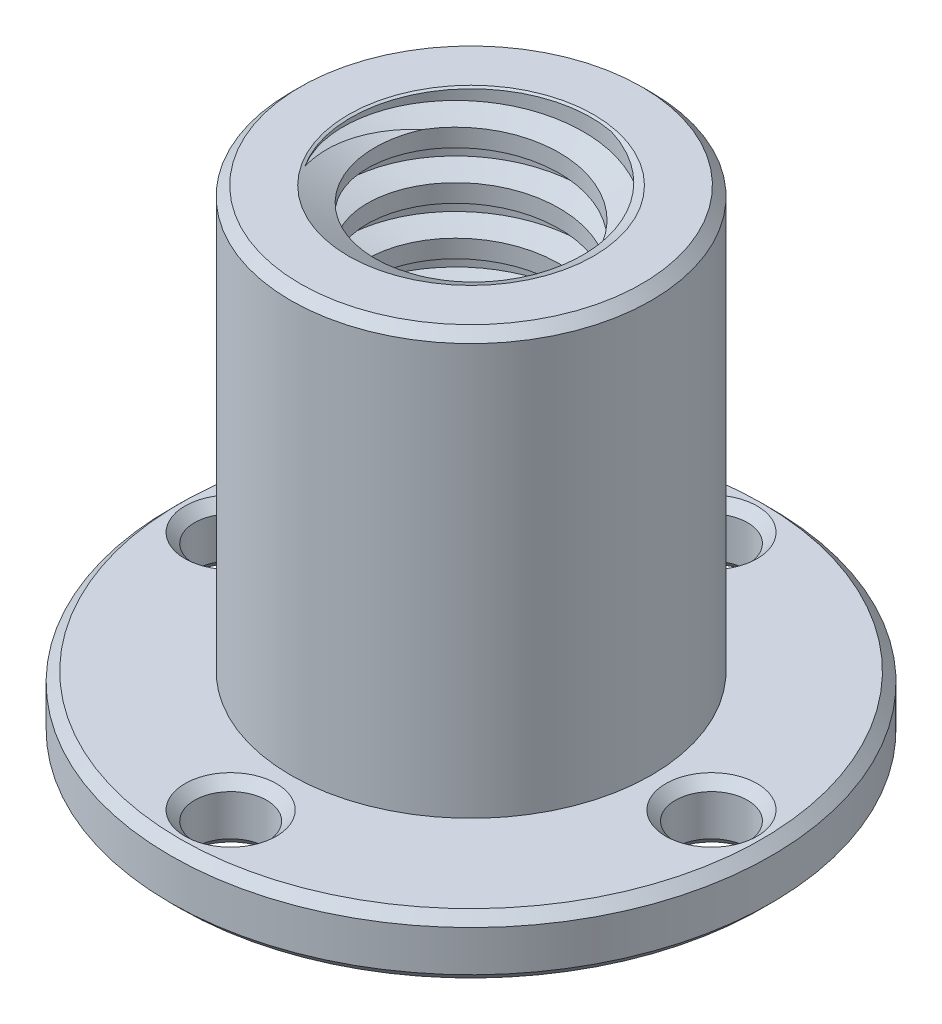
from build123d import *

# Parameters (mm, degrees)
SKETCH1_R                    = 15.875
BOSS_EXTRUDE1_DEPTH          = 25.4
CUT_EXTRUDE1_REACH           = 35.9
SKETCH2_R                    = 6.35
SWEEP1_PITCH                 = 2.54
SKETCH5_R                    = 6.477
CUT_EXTRUDE3_OTHER_WAY_DEPTH = 36.842421757
CUT_EXTRUDE3_OTHER_WAY_TAPER = -60
SKETCH6_R                    = 6.477
CUT_EXTRUDE4_OTHER_WAY_DEPTH = 34.899723619
CUT_EXTRUDE4_OTHER_WAY_TAPER = -60
SKETCH7_OUTSIDE_W            = 44.068
SKETCH7_OUTSIDE_H            = 44.068
SKETCH7_OUTSIDE_R            = 9.525
CUT_EXTRUDE5_DEPTH           = 22.225
SKETCH8_R                    = 1.905
CUT_EXTRUDE6_DEPTH           = 32.590851198
CHAMFER1_SIZE                = 0.508


with BuildPart() as part:
    # Sketch1 → Boss-Extrude1 (new body)
    with BuildSketch(Plane(origin=(0, 0, 0), x_dir=(1, 0, 0), z_dir=(0, 1, 0))):
        with Locations(Location((0, 0, 0), (0, 0, 270))):
            Circle(SKETCH1_R)
    extrude(amount=BOSS_EXTRUDE1_DEPTH)

    # Sketch2 → Cut-Extrude1 (cut, up to next)
    with BuildSketch(Plane(origin=(0, 25.4, 0), x_dir=(1, 0, 0), z_dir=(0, 1, 0)), mode=Mode.PRIVATE) as cut_extrude1_sk1:
        with Locations(Location((0, 0, 0), (0, 0, 270))):
            Circle(SKETCH2_R)
    cut_extrude1_tool1 = extrude(cut_extrude1_sk1.sketch, amount=-CUT_EXTRUDE1_REACH, mode=Mode.PRIVATE) & part.part
    add(cut_extrude1_tool1.solids().sort_by_distance((0, 25.4, 0))[0], mode=Mode.SUBTRACT)

    # Sweep1: the profile of Sketch4 profile screwed along a right-hand helix of 11 turns, 10 arcs to a turn; built about Z, then put on its axis
    sweep1_z = Axis((0, 0, 0), (0, 0, 1))
    sweep1_corners = [(6.3503, 0, -1.598521917), (5.08, 0, -1.27), (5.08, 0, -0.328444332), (6.3503, 0, 7.7585e-05)]
    with BuildLine(mode=Mode.PRIVATE) as sweep1_profile:
        Line(sweep1_corners[0], sweep1_corners[1])
        Line(sweep1_corners[1], sweep1_corners[2])
        Line(sweep1_corners[2], sweep1_corners[3])
        Line(sweep1_corners[3], sweep1_corners[0])
    sweep1_cap = Face(sweep1_profile.wire())
    sweep1_turn_angles = [0, 18, 36, 54, 72, 90, 108, 126, 144, 162, 180, 198, 216, 234, 252, 270, 288, 306, 324, 342, 360]
    sweep1_turn_weights = [1, 0.9510565162951535, 1, 0.9510565162951535, 1, 0.9510565162951535, 1, 0.9510565162951535, 1, 0.9510565162951535, 1, 0.9510565162951535, 1, 0.9510565162951535, 1, 0.9510565162951535, 1, 0.9510565162951535, 1, 0.9510565162951535, 1]
    sweep1_turn_rails = [Edge.make_bspline([Vector(p[0], p[1], 0).rotate(sweep1_z, sweep1_turn_angles[k]) / sweep1_turn_weights[k] + Vector(0, 0, p[2] + SWEEP1_PITCH * sweep1_turn_angles[k] / 360) for k in range(21)], [0, 0, 0, 1, 1, 2, 2, 3, 3, 4, 4, 5, 5, 6, 6, 7, 7, 8, 8, 9, 9, 10, 10, 10], 2, sweep1_turn_weights) for p in sweep1_corners]
    sweep1_turn_sides = [Face.make_surface_from_curves(sweep1_turn_rails[p[0]], sweep1_turn_rails[p[1]]) for p in [(0, 1), (1, 2), (2, 3), (3, 0)]]
    sweep1 = Plane(origin=(0, 25.4, 0), x_dir=(0, 0, -1), z_dir=(0, -1, 0)) * Solid(Shell([*[p.moved(Location((0, 0, SWEEP1_PITCH * i))) for i in range(11) for p in sweep1_turn_sides], sweep1_cap, sweep1_cap.rotate(sweep1_z, 3960).moved(Location((0, 0, SWEEP1_PITCH * 3960 / 360)))]))
    add(sweep1)

    # Cut-Extrude3 cone 1 section (through the dimple's axis) → Cut-Extrude3 (revolve, cut)
    with BuildSketch(Plane(origin=(0, 25.4, 0), x_dir=(0, 0, 1), z_dir=(1, 0, 0))):
        Polygon((0, 0), (6.477, 0), (0, 3.739497694), align=None)
    revolve(axis=Axis((0, 25.4, 0), (0, -1, 0)), mode=Mode.SUBTRACT)

    # Sketch5 → Cut-Extrude3 other way (cut)
    with BuildSketch(Plane(origin=(0, 25.4, 0), x_dir=(1, 0, 0), z_dir=(0, 1, 0))):
        Circle(SKETCH5_R)
    extrude(amount=CUT_EXTRUDE3_OTHER_WAY_DEPTH, taper=CUT_EXTRUDE3_OTHER_WAY_TAPER, mode=Mode.SUBTRACT)

    # Cut-Extrude4 cone 1 section (through the dimple's axis) → Cut-Extrude4 (revolve, cut)
    with BuildSketch(Plane(origin=(0, 0, 0), x_dir=(0, 0, -1), z_dir=(1, 0, 0))):
        Polygon((0, 0), (6.477, 0), (0, 3.739497694), align=None)
    revolve(axis=Axis((0, 0, 0), (0, 1, 0)), mode=Mode.SUBTRACT)

    # Sketch6 → Cut-Extrude4 other way (cut)
    with BuildSketch(Plane.XZ):
        Circle(SKETCH6_R)
    extrude(amount=CUT_EXTRUDE4_OTHER_WAY_DEPTH, taper=CUT_EXTRUDE4_OTHER_WAY_TAPER, mode=Mode.SUBTRACT)

    # Sketch7 outside → Cut-Extrude5 (cut)
    with BuildSketch(Plane(origin=(0, 25.4, 0), x_dir=(1, 0, 0), z_dir=(0, 1, 0))):
        Rectangle(SKETCH7_OUTSIDE_W, SKETCH7_OUTSIDE_H)
        with Locations(Location((0, 0, 0), (0, 0, 270))):
            Circle(SKETCH7_OUTSIDE_R, mode=Mode.SUBTRACT)
    extrude(amount=-CUT_EXTRUDE5_DEPTH, mode=Mode.SUBTRACT)

    # Sketch8 → Cut-Extrude6 (cut, through all)
    with BuildSketch(Plane(origin=(0, 3.175, 0), x_dir=(1, 0, 0), z_dir=(0, 1, 0))):
        with Locations(Location((-12.7, 0, 0), (0, 0, 270))):
            Circle(SKETCH8_R)
        with Locations(Location((0, 12.7, 0), (0, 0, 270))):
            Circle(SKETCH8_R)
        with Locations(Location((12.7, 0, 0), (0, 0, 270))):
            Circle(SKETCH8_R)
        with Locations(Location((0, -12.7, 0), (0, 0, 270))):
            Circle(SKETCH8_R)
    extrude(amount=-CUT_EXTRUDE6_DEPTH, mode=Mode.SUBTRACT)

    # Chamfer1
    chamfer1_edges = [part.edges().sort_by_distance(p)[0] for p in [
        (0, 0, -14.605),
        (0, 3.175, -14.605),
        (12.7, 0, -1.905),
        (12.7, 3.175, -1.905),
        (0, 0, 10.795),
        (0, 3.175, 10.795),
        (0, 0, -15.875),
        (0, 25.4, -9.525),
        (0, 3.175, -15.875),
        (-12.7, 0, -1.905),
        (-12.7, 3.175, -1.905),
    ]]
    chamfer(chamfer1_edges, length=CHAMFER1_SIZE)


solid = part.part
